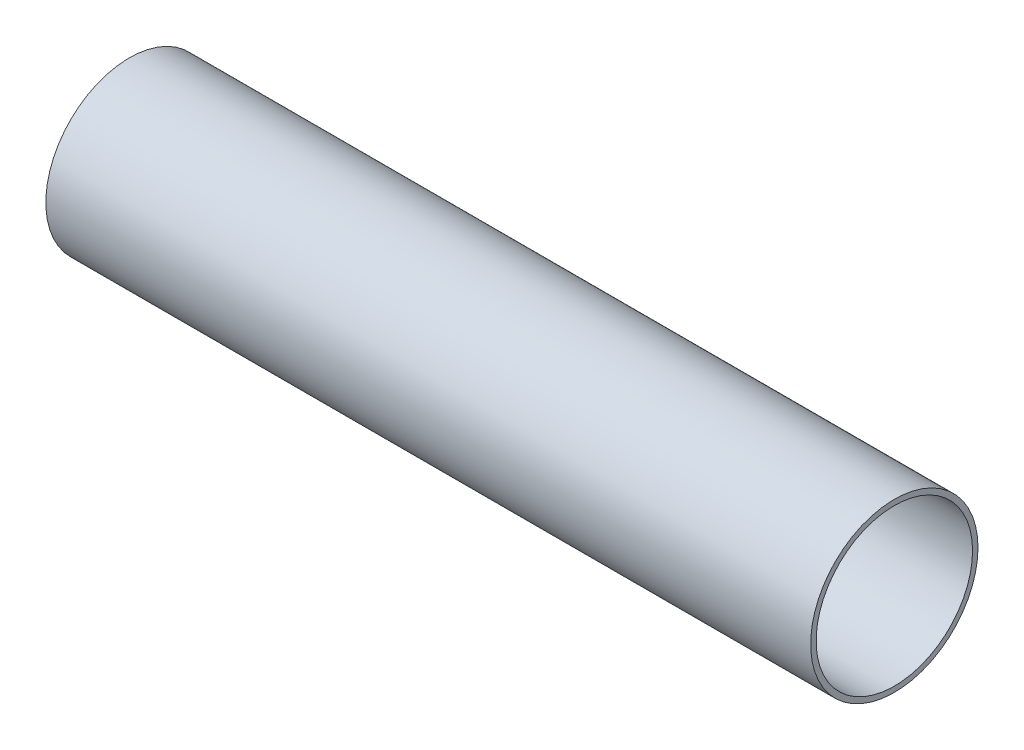
from build123d import *

# Parameters (mm, degrees)
SKETCH1_R           = 45.847
SKETCH1_R_2         = 42.8625
BOSS_EXTRUDE1_DEPTH = 419.1


with BuildPart() as part:
    # Sketch1 → Boss-Extrude1 (new body)
    with BuildSketch(Plane(origin=(0, 0, 0), x_dir=(0, 0, -1), z_dir=(1, 0, 0))):
        Circle(SKETCH1_R)
        Circle(SKETCH1_R_2, mode=Mode.SUBTRACT)
    extrude(amount=BOSS_EXTRUDE1_DEPTH)


solid = part.part
